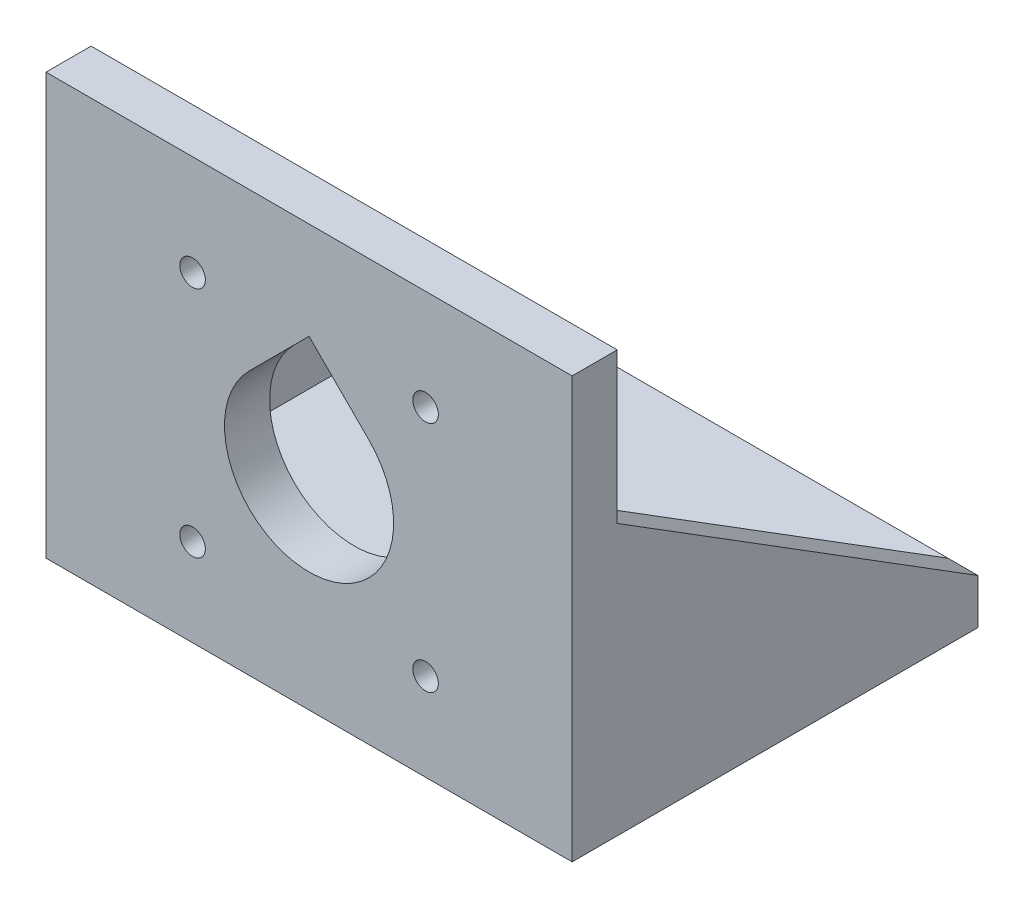
from build123d import *

# Parameters (mm, degrees)
SKETCH_01_W                   = 70
SKETCH_01_H                   = 56
EXTRUDE_01_DEPTH              = 6
SKETCH_02_W                   = 70
SKETCH_02_H                   = 54
EXTRUDE_02_DEPTH              = 6
EXTRUDE_03_DEPTH              = 4
EXTRUDE_START                 = 66
EXTRUDE_04_DEPTH              = 4
CUT_EXTRUDE_05_4_3_DEPTH      = 102.685790551
CUT_EXTRUDE_05_4_3_DEPTH_BACK = 102.685790551
SKETCH_05_R                   = 11.25
SKETCH_05_R_2                 = 1.7
CUT_EXTRUDE_06_DEPTH          = 102.685790551
CUT_EXTRUDE_06_DEPTH_BACK     = 102.685790551
CUT_EXTRUDE_07_4_4_DEPTH      = 102.685790551
CUT_EXTRUDE_07_4_4_DEPTH_BACK = 102.685790551
SKETCH_07_R                   = 2.25


with BuildPart() as part:
    # 01_Пластина_эскиз → 01_Передняя_пластина (new body)
    with BuildSketch(Plane.XY):
        with Locations((35, 28)):
            Rectangle(SKETCH_01_W, SKETCH_01_H)
    extrude(amount=EXTRUDE_01_DEPTH)

    # 02_Полка_эскиз → 02_Полка (add)
    with BuildSketch(Plane(origin=(0, 0, 0), x_dir=(1, 0, 0), z_dir=(0, 1, 0))):
        with Locations((35, 21)):
            Rectangle(SKETCH_02_W, SKETCH_02_H)
    extrude(amount=EXTRUDE_02_DEPTH)

    # 03_Косынка_левая_эскиз → 03_Косынка_левая (add)
    with BuildSketch(Plane(origin=(0, 0, 0), x_dir=(0, 0, -1), z_dir=(1, 0, 0))):
        Polygon((48, 6), (0, 6), (0, 36), align=None)
    extrude(amount=EXTRUDE_03_DEPTH)

    # 04_Косынка_правая_эскиз → 04_Косынка_правая (add)
    with BuildSketch(Plane(origin=(0, 0, 0), x_dir=(0, 0, -1), z_dir=(1, 0, 0)).offset(EXTRUDE_START)):
        Polygon((48, 6), (0, 6), (0, 36), align=None)
    extrude(amount=EXTRUDE_04_DEPTH)

    # 05_Мотор_передний_фланец_эскиз → 05_Буртик_и_4_отверстия_М3 (cut, two sides: drawn at the far end of the back side and taken through both)
    with BuildSketch(Plane.XY.offset(-CUT_EXTRUDE_05_4_3_DEPTH_BACK)):
        with Locations((35, 27.15)):
            Circle(SKETCH_05_R)
        with Locations((19.5, 11.65)):
            Circle(SKETCH_05_R_2)
        with Locations((19.5, 42.65)):
            Circle(SKETCH_05_R_2)
        with Locations((50.5, 11.65)):
            Circle(SKETCH_05_R_2)
        with Locations((50.5, 42.65)):
            Circle(SKETCH_05_R_2)
    extrude(amount=CUT_EXTRUDE_05_4_3_DEPTH + CUT_EXTRUDE_05_4_3_DEPTH_BACK, mode=Mode.SUBTRACT)

    # 06_Свод_45град_эскиз → 06_Свод_отверстия_для_печати (cut, two sides: drawn at the far end of the back side and taken through both)
    with BuildSketch(Plane.XY.offset(-CUT_EXTRUDE_06_DEPTH_BACK)):
        Polygon((27.045048712, 35.104951288), (42.954951288, 35.104951288), (35, 43.059902577), align=None)
    extrude(amount=CUT_EXTRUDE_06_DEPTH + CUT_EXTRUDE_06_DEPTH_BACK, mode=Mode.SUBTRACT)

    # 07_Крепление_полки_эскиз → 07_4_отверстия_М4 (cut, two sides: drawn at the far end of the back side and taken through both)
    with BuildSketch(Plane(origin=(0, 0, 0), x_dir=(1, 0, 0), z_dir=(0, 1, 0)).offset(-CUT_EXTRUDE_07_4_4_DEPTH_BACK)):
        with Locations((8.5, 12)):
            Circle(SKETCH_07_R)
        with Locations((8.5, 38)):
            Circle(SKETCH_07_R)
        with Locations((61.5, 12)):
            Circle(SKETCH_07_R)
        with Locations((61.5, 38)):
            Circle(SKETCH_07_R)
    extrude(amount=CUT_EXTRUDE_07_4_4_DEPTH + CUT_EXTRUDE_07_4_4_DEPTH_BACK, mode=Mode.SUBTRACT)


solid = part.part
